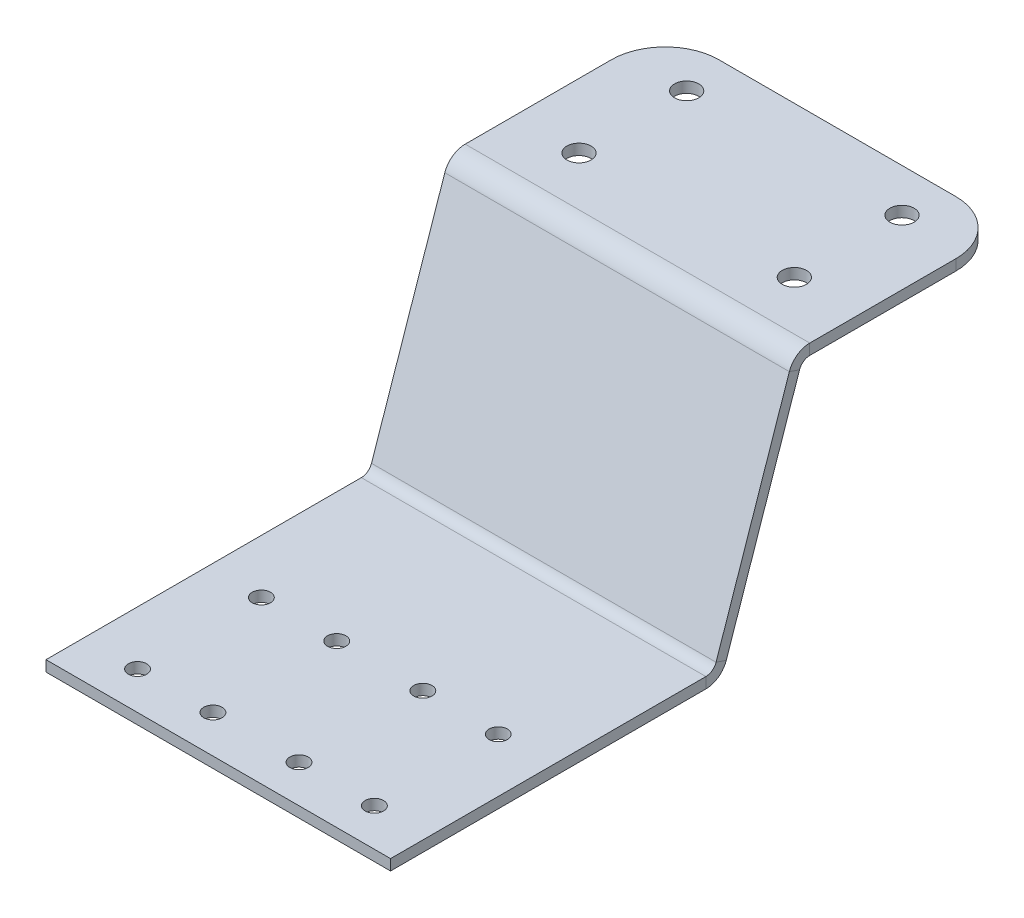
from build123d import *

# Parameters (mm, degrees)
BASE_FLANGE1_DEPTH   = 32
M3_CLEARANCE_HOLE1_D = 3.4
M4_CLEARANCE_HOLE1_D = 4.5
FILLET1_R            = 10


# Sheet-metal steps are written as plain solids
with BuildPart() as part:
    # Sketch1 → Base-Flange1 (new, symmetric)
    with BuildSketch(Plane(origin=(0, 0, 0), x_dir=(0, 0, -1), z_dir=(1, 0, 0))):
        with BuildLine():
            Line((0, 0), (58.568792855, 0))
            ThreePointArc((58.568792855, 0), (59.732688101, 0.373547463), (60.461813231, 1.354652144))
            Line((60.461813231, 1.354652144), (74.076373538, 41.290695711))
            ThreePointArc((74.076373538, 41.290695711), (75.534623798, 43.252905074), (77.862414291, 44))
            Line((77.862414291, 44), (115, 44))
            Line((115, 44), (115, 42))
            Line((115, 42), (77.862414291, 42))
            ThreePointArc((77.862414291, 42), (76.698519044, 41.626452537), (75.969393914, 40.645347856))
            Line((75.969393914, 40.645347856), (62.354833607, 0.709304289))
            ThreePointArc((62.354833607, 0.709304289), (60.896583347, -1.252905074), (58.568792855, -2))
            Line((58.568792855, -2), (0, -2))
            Line((0, -2), (0, 0))
        make_face()
    extrude(amount=BASE_FLANGE1_DEPTH, both=True)

    # M3 Clearance Hole1 (through all)
    with Locations(Plane(origin=(0, 0, 0), x_dir=(1, 0, 0), z_dir=(0, 1, 0))):
        with Locations((-22, 30), (-22, 7), (-8, 7), (-8, 30), (8, 30), (8, 7), (22, 7), (22, 30)):
            Hole(M3_CLEARANCE_HOLE1_D / 2)

    # M4 Clearance Hole1 (through all)
    with Locations(Plane(origin=(0, 44, 0), x_dir=(1, 0, 0), z_dir=(0, 1, 0))):
        with Locations((-20, 107), (-20, 87), (20, 87), (20, 107)):
            Hole(M4_CLEARANCE_HOLE1_D / 2)

    # Fillet1
    fillet1_edges = [part.edges().sort_by_distance(p)[0] for p in [
        (-32, 43, -115),
        (32, 43, -115),
    ]]
    fillet(fillet1_edges, radius=FILLET1_R)


solid = part.part
